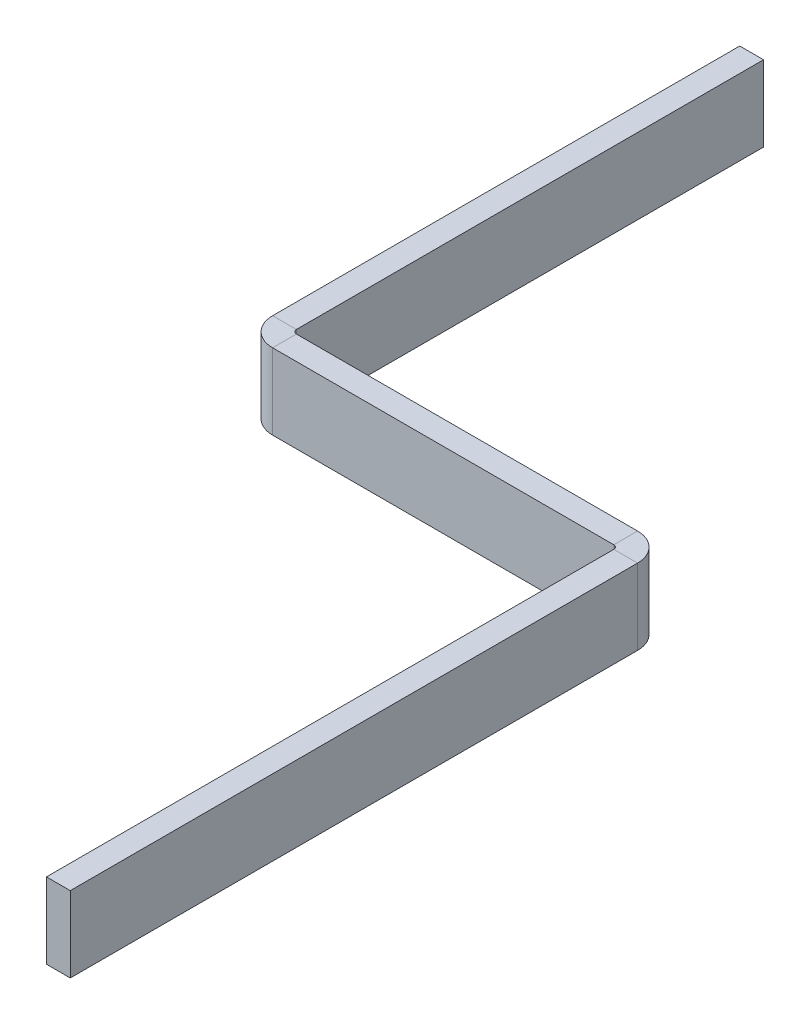
from build123d import *

# Parameters (mm, degrees)
SKETCH1_W                    = 124.750351958
SKETCH1_H                    = 19.070117496
BASE_FLANGE1_DEPTH           = 6
EDGE_FLANGE1_STRIP_W         = 26
EDGE_FLANGE1_STRIP_H         = 6
EDGE_FLANGE1_STRIP_CUT_DEPTH = 19.070117497
EDGE_FLANGE1_DEPTH           = 19.070117497
EDGE_FLANGE2_STRIP_W         = 26
EDGE_FLANGE2_STRIP_H         = 6
EDGE_FLANGE2_STRIP_CUT_DEPTH = 19.070117497
EDGE_FLANGE2_DEPTH           = 19.070117497


# Sheet-metal steps are written as plain solids
with BuildPart() as part:
    # Sketch1 → Base-Flange1 (new body)
    with BuildSketch(Plane(origin=(0, 0, 0), x_dir=(0, 0, -1), z_dir=(1, 0, 0))):
        Rectangle(SKETCH1_W, SKETCH1_H)
    extrude(amount=-BASE_FLANGE1_DEPTH)

    # Edge-Flange1 strip (across the edge) → Edge-Flange1 strip cut (cut)
    with BuildSketch(Plane(origin=(0, 9.535058748, 62.375175979), x_dir=(0, 0, -1), z_dir=(0, -1, 0))):
        with Locations((-6, -3)):
            Rectangle(EDGE_FLANGE1_STRIP_W, EDGE_FLANGE1_STRIP_H)
    extrude(amount=EDGE_FLANGE1_STRIP_CUT_DEPTH, mode=Mode.SUBTRACT)

    # Edge-Flange1 section (across the edge) → Edge-Flange1 (add)
    with BuildSketch(Plane(origin=(0, 9.535058748, 62.375175979), x_dir=(0, 0, -1), z_dir=(0, -1, 0))):
        with BuildLine():
            Line((0, 1), (0, 94))
            Line((0, 94), (6, 94))
            Line((6, 94), (6, 1))
            ThreePointArc((6, 1), (6.292893219, 0.292893219), (7, 0))
            Line((7, 0), (7, -6))
            ThreePointArc((7, -6), (2.050252532, -3.949747468), (0, 1))
        make_face()
    extrude(amount=EDGE_FLANGE1_DEPTH)

    # Edge-Flange2 strip (across the edge) → Edge-Flange2 strip cut (cut)
    with BuildSketch(Plane(origin=(94, -9.535058748, 62.375175979), x_dir=(-1, 0, 0), z_dir=(0, 1, 0))):
        with Locations((-6, -3)):
            Rectangle(EDGE_FLANGE2_STRIP_W, EDGE_FLANGE2_STRIP_H)
    extrude(amount=EDGE_FLANGE2_STRIP_CUT_DEPTH, mode=Mode.SUBTRACT)

    # Edge-Flange2 section (across the edge) → Edge-Flange2 (add)
    with BuildSketch(Plane(origin=(94, -9.535058748, 62.375175979), x_dir=(-1, 0, 0), z_dir=(0, 1, 0))):
        with BuildLine():
            Line((0, 1), (0, 144))
            Line((0, 144), (6, 144))
            Line((6, 144), (6, 1))
            ThreePointArc((6, 1), (6.292893219, 0.292893219), (7, 0))
            Line((7, 0), (7, -6))
            ThreePointArc((7, -6), (2.050252532, -3.949747468), (0, 1))
        make_face()
    extrude(amount=EDGE_FLANGE2_DEPTH)


solid = part.part
